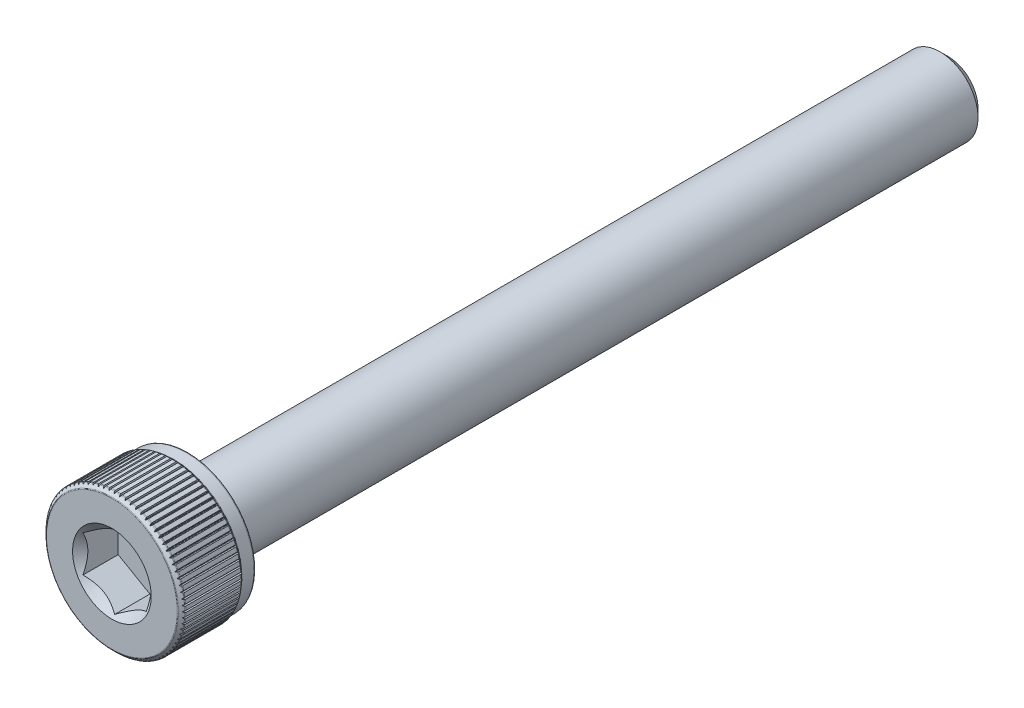
from build123d import *

# Parameters (mm, degrees)
CUT_EXTRUDE1_START = -1.5
CUT_EXTRUDE1_DEPTH = 1.5
SKETCH4_R          = 1.551628848
CUT_EXTRUDE2_DEPTH = 1.5
CUT_EXTRUDE2_TAPER = 45
CUT_EXTRUDE3_DEPTH = 34.228376444
CIRPATTERN1_COUNT  = 80


with BuildPart() as part:
    # Sketch2 → Revolve1 (revolve)
    with BuildSketch(Plane(origin=(0, 0, 0), x_dir=(0, 0, -1), z_dir=(1, 0, 0))):
        with BuildLine():
            Line((-16.5, 0), (-16.5, 2.580583739))
            ThreePointArc((-16.5, 2.580583739), (-16.496431853, 2.598522025), (-16.48627063, 2.61372937))
            Line((-16.48627063, 2.61372937), (-16.36372937, 2.73627063))
            ThreePointArc((-16.36372937, 2.73627063), (-16.348522025, 2.746431853), (-16.330583739, 2.75))
            Line((-16.330583739, 2.75), (-14.156916261, 2.75))
            ThreePointArc((-14.156916261, 2.75), (-14.138977975, 2.746431853), (-14.12377063, 2.73627063))
            Line((-14.12377063, 2.73627063), (-14.07622937, 2.68872937))
            ThreePointArc((-14.07622937, 2.68872937), (-14.061022025, 2.678568147), (-14.043083739, 2.675))
            Line((-14.043083739, 2.675), (-13.56875, 2.675))
            ThreePointArc((-13.56875, 2.675), (-13.520136409, 2.654863591), (-13.5, 2.60625))
            Line((-13.5, 2.60625), (-13.5, 1.65))
            ThreePointArc((-13.5, 1.65), (-13.456066017, 1.543933983), (-13.35, 1.5))
            Line((-13.35, 1.5), (16.175240474, 1.5))
            Line((16.175240474, 1.5), (16.5, 1.175240474))
            Line((16.5, 1.175240474), (16.5, 0))
            Line((16.5, 0), (-16.5, 0))
        make_face()
    revolve(axis=Axis((0, 0, -16.5), (0, 0, 1)))

    # Sketch3 → Cut-Extrude1 (cut)
    with BuildSketch(Plane.XY.offset(16.5).offset(CUT_EXTRUDE1_START)):
        Polygon((1.25, -0.721687836), (1.25, 0.721687836), (0, 1.443375673), (-1.25, 0.721687836), (-1.25, -0.721687836), (0, -1.443375673), align=None)
    extrude(amount=CUT_EXTRUDE1_DEPTH, mode=Mode.SUBTRACT)

    # Sketch4 → Cut-Extrude2 (cut)
    with BuildSketch(Plane.XY.offset(16.5)):
        Circle(SKETCH4_R)
    extrude(amount=-CUT_EXTRUDE2_DEPTH, taper=CUT_EXTRUDE2_TAPER, mode=Mode.SUBTRACT)

    # Sketch8 → Revolve2 (revolve)
    with BuildSketch(Plane(origin=(0, 0, 0), x_dir=(0, 0, -1), z_dir=(1, 0, 0))):
        with BuildLine():
            Line((-15, 0), (-15, 1.65))
            Line((-15, 1.65), (-13.5, 1.65))
            ThreePointArc((-13.5, 1.65), (-13.456066017, 1.543933983), (-13.35, 1.5))
            Line((-13.35, 1.5), (-13.25, 1.5))
            Line((-13.25, 1.5), (-12.383974596, 0))
            Line((-12.383974596, 0), (-15, 0))
        make_face()
    revolve(axis=Axis((0, 0, 12.383974596), (0, 0, 1)))

    # Sketch9 → Cut-Extrude3 (cut, through all)
    with BuildSketch(Plane.XY.offset(16.5)):
        with BuildLine():
            Line((-0.012548982, 2.703020303), (-0.06875, 2.828510126))
            Line((-0.06875, 2.828510126), (0.06875, 2.828510126))
            Line((0.06875, 2.828510126), (0.012548982, 2.703020303))
            ThreePointArc((0.012548982, 2.703020303), (0, 2.694890405), (-0.012548982, 2.703020303))
        make_face()
    cut_extrude3 = extrude(amount=-CUT_EXTRUDE3_DEPTH, mode=Mode.SUBTRACT)

    # CirPattern1: Cut-Extrude3 ×80 about axis
    cirpattern1_axis = Axis((0, 0, 0), (0, 0, 1))
    for i in range(1, CIRPATTERN1_COUNT):
        add(cut_extrude3.rotate(cirpattern1_axis, i * 360 / CIRPATTERN1_COUNT), mode=Mode.SUBTRACT)


solid = part.part
